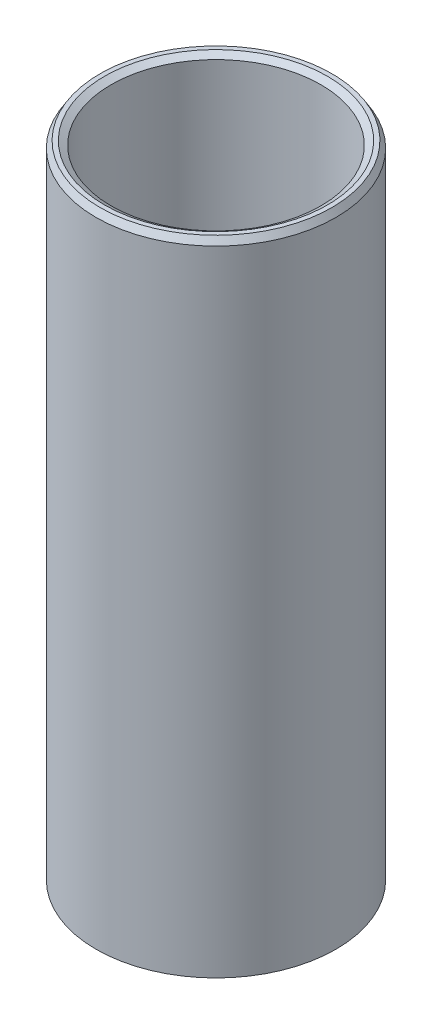
from build123d import *
from OCP.BRepFilletAPI import BRepFilletAPI_MakeChamfer

# Parameters (mm, degrees)
SKETCH1_R           = 40
BOSS_EXTRUDE1_DEPTH = 214.823332465
SKETCH2_R           = 34.988185403
CUT_EXTRUDE1_DEPTH  = 223.146492593
CHAMFER1_SIZE       = 2.183395911
CHAMFER1_SIZE2      = 1.346224452


with BuildPart() as part:
    # Sketch1 → Boss-Extrude1 (new body)
    with BuildSketch(Plane(origin=(0, 0, 0), x_dir=(1, 0, 0), z_dir=(0, 1, 0))):
        Circle(SKETCH1_R)
    extrude(amount=BOSS_EXTRUDE1_DEPTH)

    # Sketch2 → Cut-Extrude1 (cut, through all)
    with BuildSketch(Plane(origin=(0, 0, 0), x_dir=(1, 0, 0), z_dir=(0, 1, 0))):
        Circle(SKETCH2_R)
    extrude(amount=CUT_EXTRUDE1_DEPTH, mode=Mode.SUBTRACT)

    # Chamfer1: one chamfer whose edges measure the first distance from different faces: ONE call of the kernel's chamfer builder (chamfer() names one face for all edges)
    chamfer1_edges_1 = [part.edges().sort_by_distance(p)[0] for p in [
        (-34.988185403, 214.823332465, 0),
    ]]
    chamfer1_side_1 = [part.faces().sort_by_distance(p)[0] for p in [
        (-38.86862915, 214.823332465, 0),
    ]]
    chamfer1_edges_2 = [part.edges().sort_by_distance(p)[0] for p in [
        (-34.988185403, 0, 0),
    ]]
    chamfer1_side_2 = [part.faces().sort_by_distance(p)[0] for p in [
        (-34.988185403, 107.411666233, 0),
    ]]
    chamfer1_edges_3 = [part.edges().sort_by_distance(p)[0] for p in [
        (-40, 0, 0),
    ]]
    chamfer1_side_3 = [part.faces().sort_by_distance(p)[0] for p in [
        (-38.86862915, 0, 0),
    ]]
    chamfer1_edges_4 = [part.edges().sort_by_distance(p)[0] for p in [
        (-40, 214.823332465, 0),
    ]]
    chamfer1_side_4 = [part.faces().sort_by_distance(p)[0] for p in [
        (-40, 107.411666233, 0),
    ]]
    chamfer1 = BRepFilletAPI_MakeChamfer(part.part.solid().wrapped)
    for e in chamfer1_edges_1:
        chamfer1.Add(CHAMFER1_SIZE, CHAMFER1_SIZE2, e.wrapped, chamfer1_side_1[0].wrapped)  # the first distance lies on this face
    for e in chamfer1_edges_2:
        chamfer1.Add(CHAMFER1_SIZE, CHAMFER1_SIZE2, e.wrapped, chamfer1_side_2[0].wrapped)  # the first distance lies on this face
    for e in chamfer1_edges_3:
        chamfer1.Add(CHAMFER1_SIZE, CHAMFER1_SIZE2, e.wrapped, chamfer1_side_3[0].wrapped)  # the first distance lies on this face
    for e in chamfer1_edges_4:
        chamfer1.Add(CHAMFER1_SIZE, CHAMFER1_SIZE2, e.wrapped, chamfer1_side_4[0].wrapped)  # the first distance lies on this face
    add(Compound.cast(chamfer1.Shape()), mode=Mode.REPLACE)


solid = part.part
